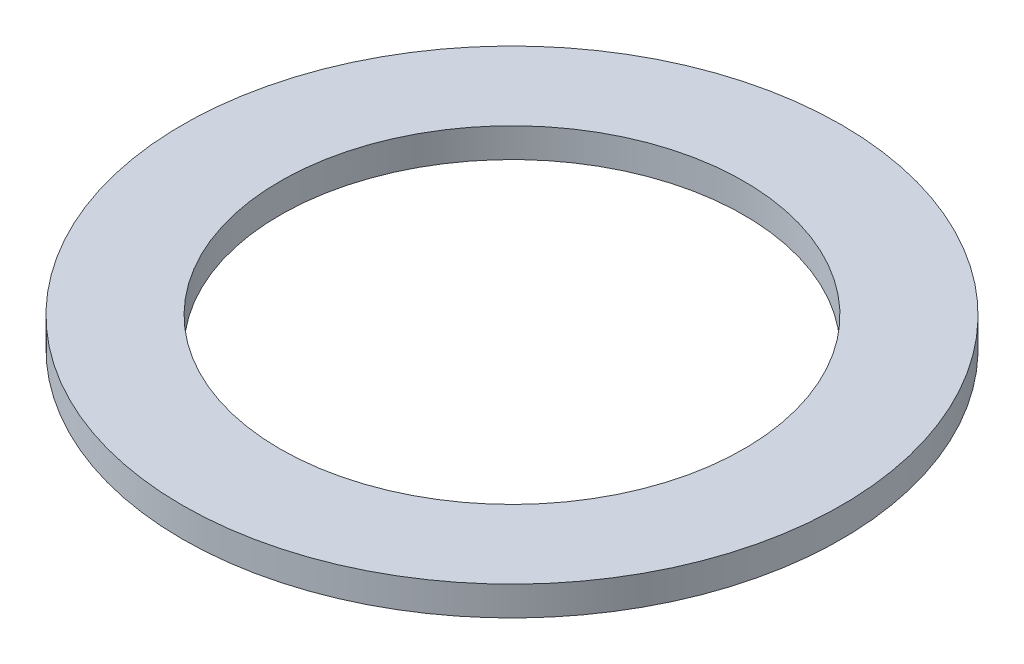
from build123d import *

# Parameters (mm, degrees)
SKETCH1_R           = 67.5
BOSS_EXTRUDE1_DEPTH = 6
SKETCH2_R           = 47.5
CUT_EXTRUDE1_DEPTH  = 96.647791402


with BuildPart() as part:
    # Sketch1 → Boss-Extrude1 (new body)
    with BuildSketch(Plane(origin=(0, 0, 0), x_dir=(1, 0, 0), z_dir=(0, 1, 0))):
        Circle(SKETCH1_R)
    extrude(amount=BOSS_EXTRUDE1_DEPTH)

    # Sketch2 → Cut-Extrude1 (cut, through all)
    with BuildSketch(Plane(origin=(0, 0, 0), x_dir=(1, 0, 0), z_dir=(0, 1, 0))):
        Circle(SKETCH2_R)
    extrude(amount=CUT_EXTRUDE1_DEPTH, mode=Mode.SUBTRACT)


solid = part.part
